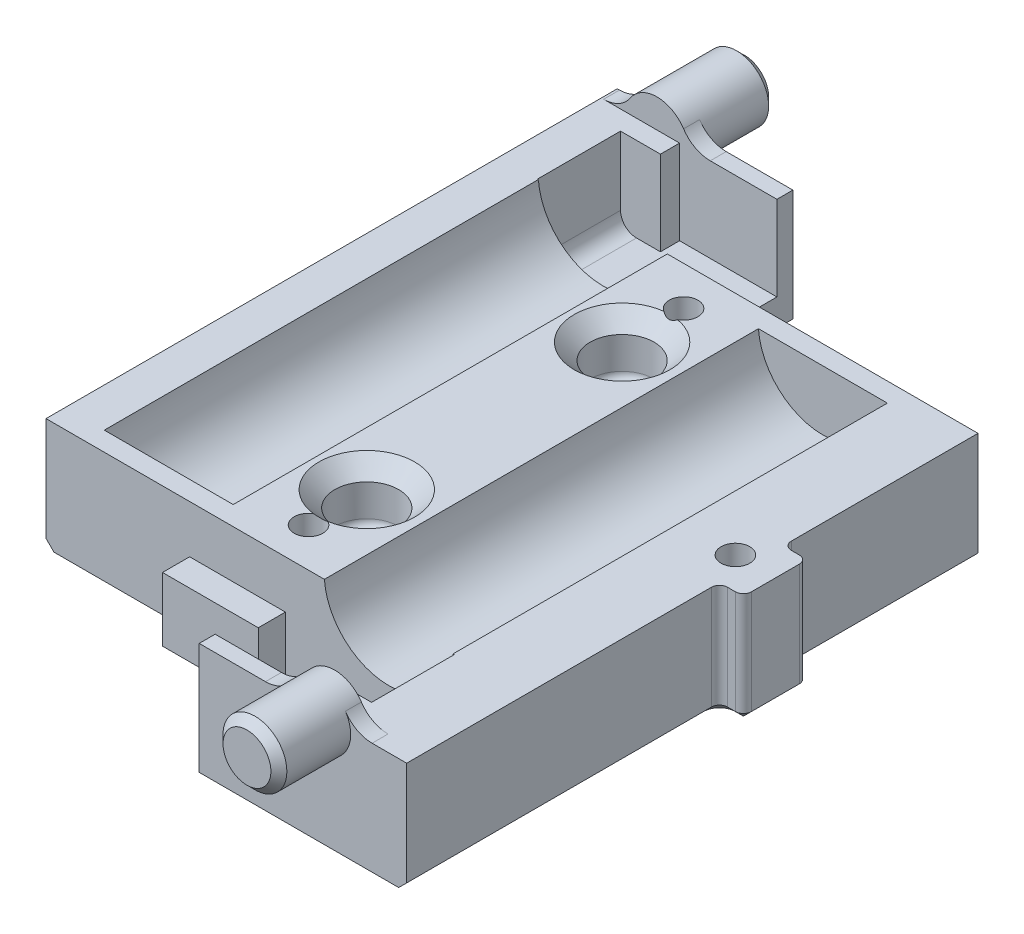
from build123d import *

# Parameters (mm, degrees)
SKETCH1_W            = 30
SKETCH1_H            = 30.8
BOSS_EXTRUDE1_DEPTH  = 7
SKETCH2_R            = 4.05
CUT_EXTRUDE1_DEPTH   = 6.5
SKETCH3_W            = 15
SKETCH3_H            = 1.2
SKETCH3_W_2          = 9
SKETCH3_W_3          = 11
SKETCH3_W_4          = 13
CUT_EXTRUDE2_DEPTH   = 4
SKETCH4_W            = 30
SKETCH4_H            = 3
CUT_EXTRUDE3_DEPTH   = 1.2
SKETCH5_W            = 30
SKETCH5_H            = 3
CUT_EXTRUDE4_DEPTH   = 1.2
SKETCH6_R            = 4.05
CUT_EXTRUDE5_DEPTH   = 27.2
SKETCH7_R            = 4.05
CUT_EXTRUDE6_DEPTH   = 27.2
BOSS_EXTRUDE2_DEPTH  = 6.4
FILLET1_R            = 1
BOSS_EXTRUDE3_DEPTH  = 6.4
FILLET2_R            = 1
SKETCH13_W           = 13
SKETCH13_H           = 7
BOSS_EXTRUDE4_DEPTH  = 1
SKETCH14_W           = 11
SKETCH14_H           = 7
BOSS_EXTRUDE5_DEPTH  = 1
SKETCH15_R           = 2
BOSS_EXTRUDE8_DEPTH  = 5.5
SKETCH16_R           = 2
BOSS_EXTRUDE9_DEPTH  = 5.5
FILLET3_R            = 2
FILLET4_R            = 2
FILLET5_R            = 2
CHAMFER2_SIZE        = 0.5
CHAMFER3_SIZE        = 0.5
SKETCH17_W           = 4
SKETCH17_H           = 7
BOSS_EXTRUDE10_DEPTH = 1.5
FILLET7_R            = 0.5
SKETCH18_R           = 0.9
CUT_EXTRUDE9_DEPTH   = 99.965895754
SKETCH19_R           = 1.6
CUT_EXTRUDE10_DEPTH  = 2
SKETCH20_R           = 0.9
CUT_EXTRUDE11_DEPTH  = 99.965895754
SKETCH21_R           = 1.6
CUT_EXTRUDE12_DEPTH  = 2
CHAMFER6_SIZE        = 0.5
SKETCH22_W           = 6
SKETCH22_H           = 4
BOSS_EXTRUDE11_DEPTH = 0.5
SKETCH23_W           = 6
SKETCH23_H           = 4
BOSS_EXTRUDE12_DEPTH = 0.5
BOSS_EXTRUDE13_REACH = 100.822
SKETCH24_W           = 4.732966807
SKETCH24_H           = 1.2
SKETCH24_W_2         = 4.75835454
SKETCH25_R           = 4.05
BOSS_EXTRUDE14_DEPTH = 7
CUT_EXTRUDE13_START  = 27.2
SKETCH26_R           = 4.05
CUT_EXTRUDE13_DEPTH  = 27.2
CUT_EXTRUDE14_START  = 27.2
SKETCH27_R           = 4.05
CUT_EXTRUDE14_DEPTH  = 27.2
SKETCH28_R           = 0.8
CUT_EXTRUDE15_DEPTH  = 99.965895754
SKETCH30_R           = 1.15
CUT_EXTRUDE16_DEPTH  = 4.7
SKETCH32_R           = 1.15
CUT_EXTRUDE17_DEPTH  = 4.7
SKETCH33_R           = 2
CUT_EXTRUDE18_DEPTH  = 3.5
FILLET8_R            = 0.5
CHAMFER7_SIZE        = 1


# Some blends are built 0.0001 mm under size
with BuildPart() as part:
    # Sketch1 → Boss-Extrude1 (new body)
    with BuildSketch(Plane(origin=(0, 0, 0), x_dir=(1, 0, 0), z_dir=(0, 1, 0))):
        with Locations((-46.45686042, -50.970505576)):
            Rectangle(SKETCH1_W, SKETCH1_H)
    extrude(amount=BOSS_EXTRUDE1_DEPTH)

    # Sketch2 → Cut-Extrude1 (cut)
    with BuildSketch(Plane.XZ):
        with Locations(Location((-47.47186042, 50.970505576, 0), (0, 0, 270))):
            Circle(SKETCH2_R)
    extrude(amount=-CUT_EXTRUDE1_DEPTH, mode=Mode.SUBTRACT)

    # Sketch3 → Cut-Extrude2 (cut)
    with BuildSketch(Plane.XZ):
        with Locations((-38.95686042, 65.770505576)):
            Rectangle(SKETCH3_W, SKETCH3_H)
        with Locations((-56.95686042, 65.770505576)):
            Rectangle(SKETCH3_W_2, SKETCH3_H)
        with Locations((-36.95686042, 36.170505576)):
            Rectangle(SKETCH3_W_3, SKETCH3_H)
        with Locations((-54.95686042, 36.170505576)):
            Rectangle(SKETCH3_W_4, SKETCH3_H)
    extrude(amount=-CUT_EXTRUDE2_DEPTH, mode=Mode.SUBTRACT)

    # Sketch4 → Cut-Extrude3 (cut)
    with BuildSketch(Plane.XY.offset(66.370505576)):
        with Locations((-46.45686042, 5.5)):
            Rectangle(SKETCH4_W, SKETCH4_H)
    extrude(amount=-CUT_EXTRUDE3_DEPTH, mode=Mode.SUBTRACT)

    # Sketch5 → Cut-Extrude4 (cut)
    with BuildSketch(Plane(origin=(0, 0, 35.570505576), x_dir=(-1, 0, 0), z_dir=(0, 0, -1))):
        with Locations((46.45686042, 5.5)):
            Rectangle(SKETCH5_W, SKETCH5_H)
    extrude(amount=-CUT_EXTRUDE4_DEPTH, mode=Mode.SUBTRACT)

    # Sketch6 → Cut-Extrude5 (cut)
    with BuildSketch(Plane.XY.offset(65.170505576)):
        with Locations((-39.974556342, 7.3)):
            Circle(SKETCH6_R)
    extrude(amount=-CUT_EXTRUDE5_DEPTH, mode=Mode.SUBTRACT)

    # Sketch7 → Cut-Extrude6 (cut)
    with BuildSketch(Plane(origin=(0, 0, 36.770505576), x_dir=(-1, 0, 0), z_dir=(0, 0, -1))):
        with Locations((54.96455223, 7.3)):
            Circle(SKETCH7_R)
    extrude(amount=-CUT_EXTRUDE6_DEPTH, mode=Mode.SUBTRACT)

    # Sketch10 → Boss-Extrude2 (add)
    with BuildSketch(Plane.XY.offset(65.170505576)):
        Polygon((-31.45686042, 0), (-31.45686042, 7), (-35.85686042, 7), (-35.85686042, 1.7), (-44.45686042, 1.7), (-44.45686042, 0), align=None)
    extrude(amount=BOSS_EXTRUDE2_DEPTH)

    # Fillet1
    fillet1_edges = [part.edges().sort_by_distance(p)[0] for p in [
        (-35.85686042, 1.7, 68.370505576),
    ]]
    fillet(fillet1_edges, radius=FILLET1_R)

    # Sketch11 → Boss-Extrude3 (add)
    with BuildSketch(Plane(origin=(0, 0, 36.770505576), x_dir=(-1, 0, 0), z_dir=(0, 0, -1))):
        Polygon((61.45686042, 7), (61.45686042, 0), (50.45686042, 0), (50.45686042, 1.7), (59.05686042, 1.7), (59.05686042, 7), align=None)
    extrude(amount=BOSS_EXTRUDE3_DEPTH)

    # Fillet2
    fillet2_edges = [part.edges().sort_by_distance(p)[0] for p in [
        (-59.05686042, 1.7, 33.570505576),
    ]]
    fillet(fillet2_edges, radius=FILLET2_R)

    # Sketch13 → Boss-Extrude4 (add)
    with BuildSketch(Plane.XY.offset(71.570505576)):
        with Locations((-37.95686042, 3.5)):
            Rectangle(SKETCH13_W, SKETCH13_H)
    extrude(amount=BOSS_EXTRUDE4_DEPTH)

    # Sketch14 → Boss-Extrude5 (add)
    with BuildSketch(Plane(origin=(0, 0, 30.370505576), x_dir=(-1, 0, 0), z_dir=(0, 0, -1))):
        with Locations((55.95686042, 3.5)):
            Rectangle(SKETCH14_W, SKETCH14_H)
    extrude(amount=BOSS_EXTRUDE5_DEPTH)

    # Sketch15 → Boss-Extrude8 (add)
    with BuildSketch(Plane.XY.offset(71.570505576)):
        with Locations(Location((-36.96455223, 6.8, 0), (0, 0, 174.260829523))):
            Circle(SKETCH15_R)
    extrude(amount=BOSS_EXTRUDE8_DEPTH)

    # Sketch16 → Boss-Extrude9 (add)
    with BuildSketch(Plane(origin=(0, 0, 30.370505576), x_dir=(-1, 0, 0), z_dir=(0, 0, -1))):
        with Locations(Location((57.974556342, 6.8, 0), (0, 0, 174.260829523))):
            Circle(SKETCH16_R)
    extrude(amount=BOSS_EXTRUDE9_DEPTH)

    # Fillet3
    fillet3_edges = [part.edges().sort_by_distance(p)[0] for p in [
        (-59.964531217, 7, 29.870505576),
    ]]
    fillet(fillet3_edges, radius=FILLET3_R)

    # Fillet4
    # the kernel refuses this fillet: 2 mm, written as the material it adds along each edge
    with BuildSketch(Plane(origin=(-55.984581468, 7, 30.370505576), x_dir=(1.0, 6.928230146476526e-12, 0), z_dir=(0, 0, -1))) as fillet4_piece_1:
        with BuildLine():
            CenterArc((1.350683743, -2), FILLET4_R, 90, 56.632987031)
            ThreePointArc((-0.319645565, -0.9), (-0.105311329, -0.469360383), (0, 0))
            Line((0, 0), (1.350683743, 0))
        make_face()
    extrude(amount=1)

    # Fillet5
    # the kernel refuses this fillet: 2 mm, written as the material it adds along each edge
    with BuildSketch(Plane(origin=(-38.954527104, 7, 71.570505576), x_dir=(0.33468019132383453, 0.9423317725384418, 0), z_dir=(0, 0, 1))) as fillet5_piece_1:
        with BuildLine():
            CenterArc((1.432616451, 1.942152589), FILLET5_R, 199.553091723, 56.632987031)
            Line((-0.452047094, 1.272792206), (0, 0))
            ThreePointArc((0, 0), (0.477538817, 0.057847411), (0.955077634, 0))
        make_face()
    extrude(amount=1)
    with BuildSketch(Plane(origin=(-34.974577356, 7, 72.570505576), x_dir=(1, 0, 0), z_dir=(0, 0, -1))) as fillet5_piece_2:
        with BuildLine():
            CenterArc((1.350683743, -2), FILLET5_R, 90, 56.632987031)
            ThreePointArc((-0.319645565, -0.9), (-0.105311329, -0.469360383), (0, 0))
            Line((0, 0), (1.350683743, 0))
        make_face()
    extrude(amount=1)

    # Chamfer2
    chamfer2_edges = [part.edges().sort_by_distance(p)[0] for p in [
        (-34.974577356, 6.6, 77.070505576),
    ]]
    chamfer(chamfer2_edges, length=CHAMFER2_SIZE)

    # Chamfer3
    chamfer3_edges = [part.edges().sort_by_distance(p)[0] for p in [
        (-59.964531217, 6.6, 24.870505576),
    ]]
    chamfer(chamfer3_edges, length=CHAMFER3_SIZE)

    # Sketch17 → Boss-Extrude10 (add)
    with BuildSketch(Plane(origin=(-31.45686042, 0, 0), x_dir=(0, 0, -1), z_dir=(1, 0, 0))):
        with Locations((-50.970505576, 3.5)):
            Rectangle(SKETCH17_W, SKETCH17_H)
    extrude(amount=BOSS_EXTRUDE10_DEPTH)

    # Fillet7
    fillet7_edges = [part.edges().sort_by_distance(p)[0] for p in [
        (-31.45686042, 3.5, 52.970505576),
        (-31.45686042, 3.5, 48.970505576),
        (-29.95686042, 3.5, 52.970505576),
        (-29.95686042, 3.5, 48.970505576),
    ]]
    fillet(fillet7_edges, radius=FILLET7_R)

    # Sketch18 → Cut-Extrude9 (cut, through all)
    with BuildSketch(Plane.XZ):
        with Locations(Location((-32.45686042, 50.970505576, 0), (0, 0, 270))):
            Circle(SKETCH18_R)
    extrude(amount=-CUT_EXTRUDE9_DEPTH, mode=Mode.SUBTRACT)

    # Sketch19 → Cut-Extrude10 (cut)
    with BuildSketch(Plane.XZ):
        with Locations(Location((-32.45686042, 50.970505576, 0), (0, 0, 270))):
            Circle(SKETCH19_R)
    extrude(amount=-CUT_EXTRUDE10_DEPTH, mode=Mode.SUBTRACT)

    # Sketch20 → Cut-Extrude11 (cut, through all)
    with BuildSketch(Plane.XZ):
        with Locations(Location((-47.45686042, 62.720505576, 0), (0, 0, 270))):
            Circle(SKETCH20_R)
        with Locations(Location((-47.45686042, 39.220505576, 0), (0, 0, 270))):
            Circle(SKETCH20_R)
    extrude(amount=-CUT_EXTRUDE11_DEPTH, mode=Mode.SUBTRACT)

    # Sketch21 → Cut-Extrude12 (cut)
    with BuildSketch(Plane.XZ):
        with Locations(Location((-47.45686042, 62.720505576, 0), (0, 0, 270))):
            Circle(SKETCH21_R)
        with Locations(Location((-47.45686042, 39.220505576, 0), (0, 0, 270))):
            Circle(SKETCH21_R)
    extrude(amount=-CUT_EXTRUDE12_DEPTH, mode=Mode.SUBTRACT)

    # Chamfer6
    chamfer6_edges = [part.edges().sort_by_distance(p)[0] for p in [
        (-61.45686042, 0, 47.270505576),
        (-31.45686042, 0, 42.620505576),
        (-31.310413811, 0, 48.824058967),
        (-30.70686042, 0, 48.970505576),
        (-30.103307029, 0, 49.116952185),
        (-29.95686042, 0, 50.970505576),
        (-30.103307029, 0, 52.824058967),
        (-30.70686042, 0, 52.970505576),
        (-31.310413811, 0, 53.116952185),
    ]]
    chamfer(chamfer6_edges, length=CHAMFER6_SIZE - 0.0001)  # a hair under: the kernel refuses the full size

    # Sketch22 → Boss-Extrude11 (add)
    with BuildSketch(Plane(origin=(0, 0, 35.570505576), x_dir=(-1, 0, 0), z_dir=(0, 0, -1))):
        with Locations((45.45686042, 2)):
            Rectangle(SKETCH22_W, SKETCH22_H)
    extrude(amount=BOSS_EXTRUDE11_DEPTH)

    # Sketch23 → Boss-Extrude12 (add)
    with BuildSketch(Plane.XY.offset(66.370505576)):
        with Locations((-49.45686042, 2)):
            Rectangle(SKETCH23_W, SKETCH23_H)
    extrude(amount=BOSS_EXTRUDE12_DEPTH)

    # Boss-Extrude13: up to this face of the body (flat: up to its plane)
    boss_extrude13_end = Plane(part.part.faces().sort_by_distance((-54.25686042, 1.7, 33.570505576))[0])
    # Sketch24 → Boss-Extrude13 (add, up to the picked face)
    with BuildSketch(Plane(origin=(0, 7, 0), x_dir=(1, 0, 0), z_dir=(0, 1, 0)), mode=Mode.PRIVATE) as boss_extrude13_sk1:
        with Locations((-35.990377017, -70.970505576)):
            Rectangle(SKETCH24_W, SKETCH24_H)
    boss_extrude13_tool1 = split(extrude(boss_extrude13_sk1.sketch, amount=-BOSS_EXTRUDE13_REACH, mode=Mode.PRIVATE), bisect_by=boss_extrude13_end, keep=Keep.BOTH, mode=Mode.PRIVATE)
    # Sketch24 → Boss-Extrude13 (add, up to the picked face)
    with BuildSketch(Plane(origin=(0, 7, 0), x_dir=(1, 0, 0), z_dir=(0, 1, 0)), mode=Mode.PRIVATE) as boss_extrude13_sk2:
        with Locations((-58.93603769, -30.970505576)):
            Rectangle(SKETCH24_W_2, SKETCH24_H)
    boss_extrude13_tool2 = split(extrude(boss_extrude13_sk2.sketch, amount=-BOSS_EXTRUDE13_REACH, mode=Mode.PRIVATE), bisect_by=boss_extrude13_end, keep=Keep.BOTH, mode=Mode.PRIVATE)
    add(boss_extrude13_tool1.solids().sort_by(Axis((-35.990377, 7, 70.970506), (0, -1, 0)))[0])
    add(boss_extrude13_tool2.solids().sort_by(Axis((-58.936038, 7, 30.970506), (0, -1, 0)))[0])

    # Sketch25 → Boss-Extrude14 (add)
    with BuildSketch(Plane.XZ):
        with Locations((-47.47186042, 50.970505576)):
            Circle(SKETCH25_R)
    extrude(amount=-BOSS_EXTRUDE14_DEPTH)

    # Sketch26 → Cut-Extrude13 (cut)
    with BuildSketch(Plane.XY.offset(37.970505576).offset(CUT_EXTRUDE13_START)):
        with Locations((-39.974556342, 7.3)):
            Circle(SKETCH26_R)
    extrude(amount=-CUT_EXTRUDE13_DEPTH, mode=Mode.SUBTRACT)

    # Sketch27 → Cut-Extrude14 (cut)
    with BuildSketch(Plane(origin=(0, 0, 63.970505576), x_dir=(-1, 0, 0), z_dir=(0, 0, -1)).offset(CUT_EXTRUDE14_START)):
        with Locations((54.96455223, 7.3)):
            Circle(SKETCH27_R)
    extrude(amount=-CUT_EXTRUDE14_DEPTH, mode=Mode.SUBTRACT)

    # Sketch28 → Cut-Extrude15 (cut, through all)
    with BuildSketch(Plane.XZ):
        with Locations(Location((-47.55686042, 58.970505576, 0), (0, 0, 270))):
            Circle(SKETCH28_R)
        with Locations(Location((-47.55686042, 42.970505576, 0), (0, 0, 270))):
            Circle(SKETCH28_R)
    extrude(amount=-CUT_EXTRUDE15_DEPTH, mode=Mode.SUBTRACT)

    # Sketch30 → Cut-Extrude16 (cut)
    with BuildSketch(Plane(origin=(0, 7, 0), x_dir=(1, 0, 0), z_dir=(0, 1, 0))):
        with Locations(Location((-47.55686042, -42.970505576, 0), (0, 0, 270))):
            Circle(SKETCH30_R)
    extrude(amount=-CUT_EXTRUDE16_DEPTH, mode=Mode.SUBTRACT)

    # Sketch32 → Cut-Extrude17 (cut)
    with BuildSketch(Plane(origin=(0, 7, 0), x_dir=(1, 0, 0), z_dir=(0, 1, 0))):
        with Locations(Location((-47.55686042, -58.970505576, 0), (0, 0, 270))):
            Circle(SKETCH32_R)
    extrude(amount=-CUT_EXTRUDE17_DEPTH, mode=Mode.SUBTRACT)

    # Sketch33 → Cut-Extrude18 (cut)
    with BuildSketch(Plane(origin=(0, 7, 0), x_dir=(1, 0, 0), z_dir=(0, 1, 0))):
        with Locations(Location((-47.55686042, -58.970505576, 0), (0, 0, 270))):
            Circle(SKETCH33_R)
        with Locations(Location((-47.55686042, -42.970505576, 0), (0, 0, 270))):
            Circle(SKETCH33_R)
    extrude(amount=-CUT_EXTRUDE18_DEPTH, mode=Mode.SUBTRACT)

    # Fillet8
    fillet8_edges = [part.edges().sort_by_distance(p)[0] for p in [
        (-47.55686042, 3.5, 56.970505576),
        (-47.55686042, 3.5, 40.970505576),
    ]]
    fillet(fillet8_edges, radius=FILLET8_R)

    # Chamfer7
    # the kernel refuses this chamfer: 1 mm, written as the material it takes off along each edge
    with BuildSketch(Plane(origin=(-47.55686042, 7, 58.970505576), x_dir=(0, 0, 1), z_dir=(-1, 0, 0))) as chamfer7_piece_1:
        Polygon((2, -CHAMFER7_SIZE), (2 + CHAMFER7_SIZE, 0), (2, 0), align=None)
    revolve(axis=Axis((-47.55686042, 7, 58.970505576), (0, 1, 0)), mode=Mode.SUBTRACT)
    with BuildSketch(Plane(origin=(-47.55686042, 7, 42.970505576), x_dir=(0, 0, 1), z_dir=(-1, 0, 0))) as chamfer7_piece_2:
        Polygon((2 + CHAMFER7_SIZE, 0), (2, -CHAMFER7_SIZE), (2, 0), align=None)
    revolve(axis=Axis((-47.55686042, 7, 42.970505576), (0, 1, 0)), mode=Mode.SUBTRACT)


solid = part.part
